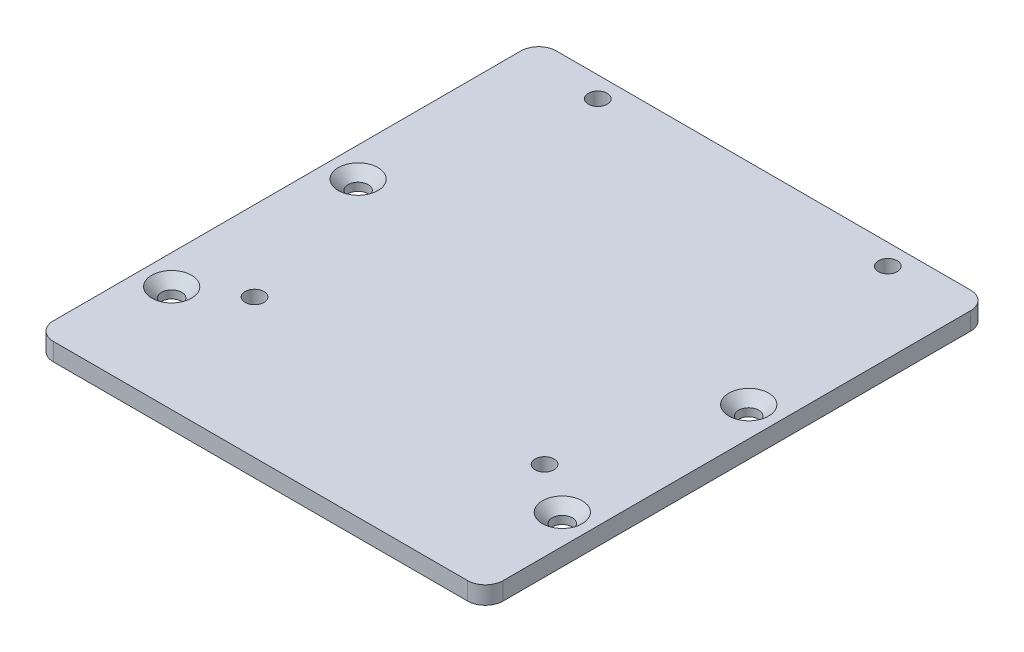
from build123d import *

# Parameters (mm, degrees)
SKETCH1_W                    = 76
SKETCH1_H                    = 85
BOSS_EXTRUDE1_DEPTH          = 3
M3_CLEARANCE_HOLE1_D         = 3.2
CSK_FOR_M3_SFHCS1_AT_2_COUNT = 2
CSK_FOR_M3_SFHCS1_AT_2_PITCH = 31.5
CSK_FOR_M3_SFHCS1_AT_3_COUNT = 2
CSK_FOR_M3_SFHCS1_AT_3_PITCH = 73.131730459
CSK_FOR_M3_SFHCS1_AT_4_COUNT = 2
CSK_FOR_M3_SFHCS1_AT_4_PITCH = 66
FILLET1_R                    = 3


with BuildPart() as part:
    # Sketch1 → Boss-Extrude1 (new body)
    with BuildSketch(Plane(origin=(0, 0, 0), x_dir=(1, 0, 0), z_dir=(0, 1, 0))):
        Rectangle(SKETCH1_W, SKETCH1_H)
    extrude(amount=BOSS_EXTRUDE1_DEPTH)

    # M3 Clearance Hole1 (through all)
    with Locations(Plane(origin=(0, 3, 0), x_dir=(1, 0, 0), z_dir=(0, 1, 0))):
        with Locations((-24.5, 39), (-24.5, -19), (24.5, -19), (24.5, 39)):
            Hole(M3_CLEARANCE_HOLE1_D / 2)

    # Sketch5 → CSK for M3 SFHCS1 (revolve, cut)
    with BuildSketch(Plane(origin=(-33, 3, 24.5), x_dir=(0, 0, 1), z_dir=(1, 0, 0))):
        Polygon((0, 0), (0, 3), (1.7, 3), (1.7, 1.66), (3.36, 0), align=None)
    csk_for_m3_sfhcs1 = revolve(axis=Axis((-33, 9.35, 24.5), (0, -1, 0)), mode=Mode.SUBTRACT)

    # CSK for M3 SFHCS1 at 2: CSK for M3 SFHCS1 ×2
    with Locations(*[(0, 0, -i * CSK_FOR_M3_SFHCS1_AT_2_PITCH) for i in range(1, CSK_FOR_M3_SFHCS1_AT_2_COUNT)]):
        add(csk_for_m3_sfhcs1, mode=Mode.SUBTRACT)

    # CSK for M3 SFHCS1 at 3: CSK for M3 SFHCS1 ×2
    with Locations(*[Vector(0.9024810377836799, 0, -0.43072958621493834) * (i * CSK_FOR_M3_SFHCS1_AT_3_PITCH) for i in range(1, CSK_FOR_M3_SFHCS1_AT_3_COUNT)]):
        add(csk_for_m3_sfhcs1, mode=Mode.SUBTRACT)

    # CSK for M3 SFHCS1 at 4: CSK for M3 SFHCS1 ×2
    with Locations(*[(i * CSK_FOR_M3_SFHCS1_AT_4_PITCH, 0, 0) for i in range(1, CSK_FOR_M3_SFHCS1_AT_4_COUNT)]):
        add(csk_for_m3_sfhcs1, mode=Mode.SUBTRACT)

    # Fillet1
    fillet1_edges = [part.edges().sort_by_distance(p)[0] for p in [
        (-38, 1.5, -42.5),
        (38, 1.5, -42.5),
        (38, 1.5, 42.5),
        (-38, 1.5, 42.5),
    ]]
    fillet(fillet1_edges, radius=FILLET1_R)


solid = part.part
